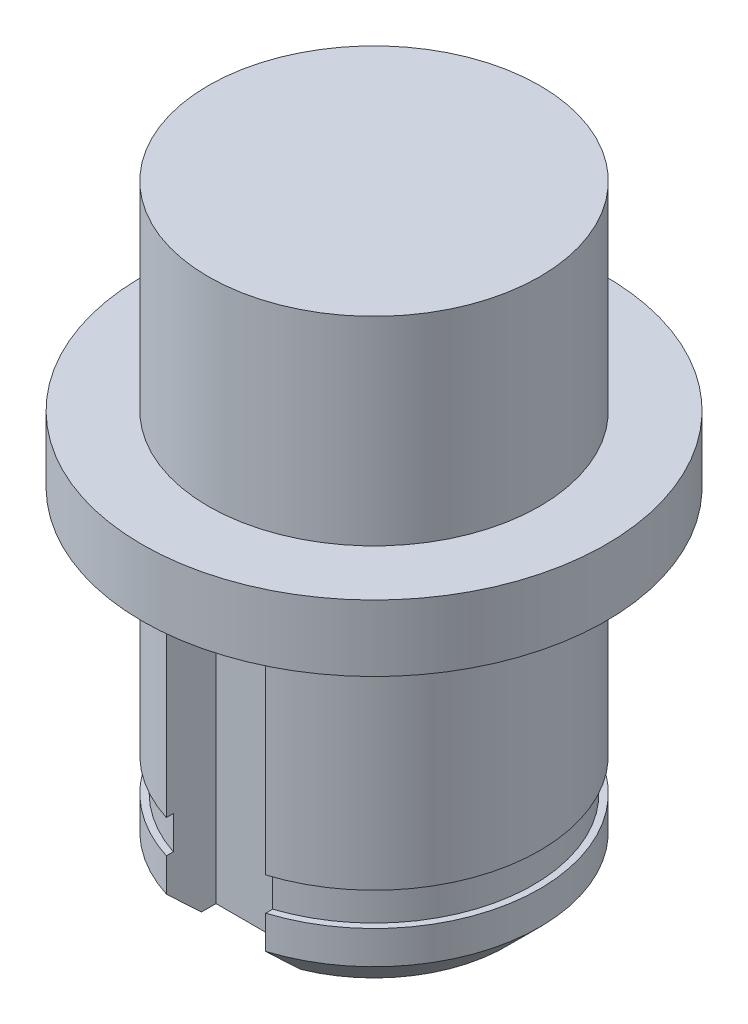
from build123d import *

# Parameters (mm, degrees)
SKETCH1_R               = 5
BOSS_EXTRUDE1_DEPTH     = 18
SKETCH2_W               = 2
SKETCH2_H               = 2
SKETCH2_5_W             = 0.2
SKETCH2_5_H             = 1
CUT_EXTRUDE1_DEPTH      = 21.542638584
CUT_EXTRUDE1_DEPTH_BACK = 10
CUT_EXTRUDE2_DEPTH      = 16
CHAMFER2_SIZE           = 1


with BuildPart() as part:
    # Sketch1 → Boss-Extrude1 (new body)
    with BuildSketch(Plane(origin=(0, 0, 0), x_dir=(1, 0, 0), z_dir=(0, 1, 0))):
        Circle(SKETCH1_R)
    extrude(amount=BOSS_EXTRUDE1_DEPTH)

    # Sketch2 → Revolve1 (revolve)
    with BuildSketch(Plane(origin=(0, 0, 0), x_dir=(0, 0, -1), z_dir=(1, 0, 0))):
        with Locations((6, 11)):
            Rectangle(SKETCH2_W, SKETCH2_H)
    revolve(axis=Axis((0, 18, 0), (0, -1, 0)))

    # Sketch2<5> → Cut-Revolve1 (revolve, cut)
    with BuildSketch(Plane(origin=(0, 0, 0), x_dir=(0, 0, -1), z_dir=(1, 0, 0))):
        with Locations((4.9, 2.5)):
            Rectangle(SKETCH2_5_W, SKETCH2_5_H)
    revolve(axis=Axis((0, 18, 0), (0, -1, 0)), mode=Mode.SUBTRACT)

    # Sketch4 → Cut-Extrude1 (cut, two sides: drawn at the far end of the back side and taken through both)
    with BuildSketch(Plane.XZ.offset(-CUT_EXTRUDE1_DEPTH_BACK)):
        Polygon((-1.5, 43.805931583), (-1.5, 4.769696007), (-1.5, 3.269696007), (1.5, 3.269696007), (1.5, 4.769696007), (1.5, 43.805931583), (1.5, 121.878402734), (-1.5, 121.878402734), align=None)
    extrude(amount=CUT_EXTRUDE1_DEPTH + CUT_EXTRUDE1_DEPTH_BACK, mode=Mode.SUBTRACT)

    # Sketch5 → Cut-Extrude2 (cut)
    with BuildSketch(Plane.XZ):
        with BuildLine():
            Line((1.5, 2), (-1.5, 2))
            ThreePointArc((-1.5, 2), (0, -2.5), (1.5, 2))
        make_face()
    extrude(amount=-CUT_EXTRUDE2_DEPTH, mode=Mode.SUBTRACT)

    # Chamfer2
    chamfer2_edges = [part.edges().sort_by_distance(p)[0] for p in [
        (0, 0, -5),
    ]]
    chamfer(chamfer2_edges, length=CHAMFER2_SIZE)


solid = part.part
